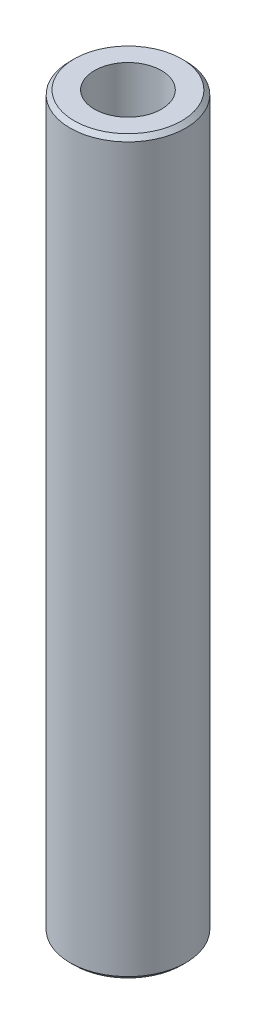
from build123d import *

# Parameters (mm, degrees)
SKETCH1_R           = 47.5
BOSS_EXTRUDE1_DEPTH = 600
SKETCH2_R           = 27.500046117
CUT_EXTRUDE1_DEPTH  = 604.748706003
CHAMFER1_SIZE       = 3.414081324


with BuildPart() as part:
    # Sketch1 → Boss-Extrude1 (new body)
    with BuildSketch(Plane(origin=(0, 0, 0), x_dir=(1, 0, 0), z_dir=(0, 1, 0))):
        Circle(SKETCH1_R)
    extrude(amount=BOSS_EXTRUDE1_DEPTH)

    # Sketch2 → Cut-Extrude1 (cut, through all)
    with BuildSketch(Plane(origin=(0, 0, 0), x_dir=(1, 0, 0), z_dir=(0, 1, 0))):
        Circle(SKETCH2_R)
    extrude(amount=CUT_EXTRUDE1_DEPTH, mode=Mode.SUBTRACT)

    # Chamfer1
    chamfer1_edges = [part.edges().sort_by_distance(p)[0] for p in [
        (-47.5, 600, 0),
        (-47.5, 0, 0),
    ]]
    chamfer(chamfer1_edges, length=CHAMFER1_SIZE)


solid = part.part
